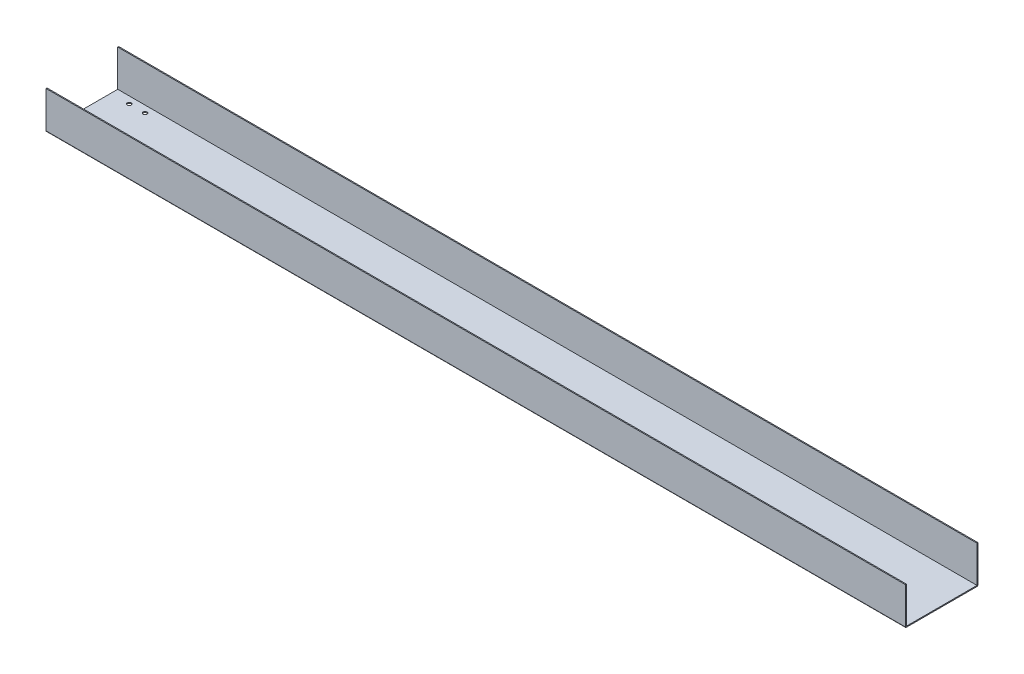
from build123d import *

# Parameters (mm, degrees)
CROQUIS1_W                      = 1300
CROQUIS1_H                      = 220
BRIDA_BASE1_DEPTH               = 1.5
PLIEGUE_START                   = -592.530487805
PLIEGUE_CROQUIZADO1_DEPTH       = 1300
PLIEGUE_CROQUIZADO1_2_OUTLINE_W = 55.321902755
PLIEGUE_CROQUIZADO1_2_OUTLINE_H = 1.5
PLIEGUE_CROQUIZADO1_2_DEPTH     = 1300
CROQUIS8_R                      = 3
CORTAR_EXTRUIR1_DEPTH           = 10


# Read off the part's stored shape, not the designer's step: Pliegue croquizado1
# Sheet-metal steps are written as plain solids
with BuildPart() as part:
    # Croquis1 → Brida base1 (new body)
    with BuildSketch(Plane(origin=(0, 0, 0), x_dir=(1, 0, 0), z_dir=(0, 1, 0))):
        with Locations((57.469512195, -13.391768293)):
            Rectangle(CROQUIS1_W, CROQUIS1_H)
    extrude(amount=-BRIDA_BASE1_DEPTH)

    # Pliegue croquizado1 outline → Pliegue croquizado1 (cut)
    with BuildSketch(Plane.YZ.offset(PLIEGUE_START)):
        with BuildLine():
            Line((0, -96.608231707), (0, -41.608231707))
            ThreePointArc((0, -41.608231707), (-1.060660172, -41.168891879), (-1.5, -40.108231707))
            Line((-1.5, -40.108231707), (-1.5, -96.608231707))
            Line((-1.5, -96.608231707), (0, -96.608231707))
        make_face()
        with BuildLine():
            Line((-1.5, 123.391768293), (-1.5, 66.891768293))
            ThreePointArc((-1.5, 66.891768293), (-1.060660171, 67.952428465), (0, 68.391768293))
            Line((0, 68.391768293), (0, 123.391768293))
            Line((0, 123.391768293), (-1.5, 123.391768293))
        make_face()
    extrude(amount=PLIEGUE_CROQUIZADO1_DEPTH, mode=Mode.SUBTRACT)

    # Pliegue croquizado1 2 outline → Pliegue croquizado1 2 (add)
    with BuildSketch(Plane.YZ.offset(PLIEGUE_START)):
        with Locations((27.660951378, -40.858231707)):
            Rectangle(PLIEGUE_CROQUIZADO1_2_OUTLINE_W, PLIEGUE_CROQUIZADO1_2_OUTLINE_H)
        with Locations((27.660951378, 67.641768293)):
            Rectangle(PLIEGUE_CROQUIZADO1_2_OUTLINE_W, PLIEGUE_CROQUIZADO1_2_OUTLINE_H)
    extrude(amount=PLIEGUE_CROQUIZADO1_2_DEPTH)

    # Croquis8 → Cortar-Extruir1 (cut)
    with BuildSketch(Plane(origin=(0, 0, 0), x_dir=(1, 0, 0), z_dir=(0, 1, 0))):
        with Locations(Location((-564.580402517, -56.391768293, 0), (0, 0, 270))):
            Circle(CROQUIS8_R)
        with Locations(Location((-540.580402517, -56.391768293, 0), (0, 0, 270))):
            Circle(CROQUIS8_R)
        with Locations(Location((-540.580402517, 29.608231707, 0), (0, 0, 270))):
            Circle(CROQUIS8_R)
        with Locations(Location((-564.580402517, 29.608231707, 0), (0, 0, 270))):
            Circle(CROQUIS8_R)
    extrude(amount=-CORTAR_EXTRUIR1_DEPTH, mode=Mode.SUBTRACT)


solid = part.part
